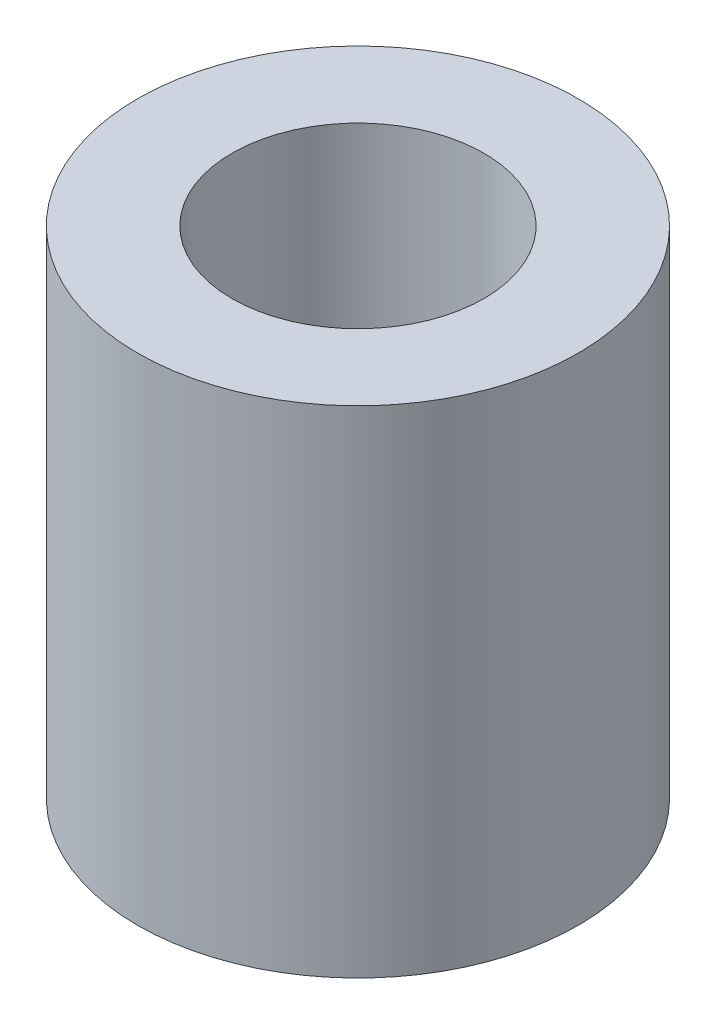
from build123d import *

# Parameters (mm, degrees)
SKETCH2_R           = 5.335
SKETCH2_R_2         = 3.05
BOSS_EXTRUDE1_DEPTH = 12


with BuildPart() as part:
    # Sketch2 → Boss-Extrude1 (new body)
    with BuildSketch(Plane(origin=(0, 0, 0), x_dir=(1, 0, 0), z_dir=(0, 1, 0))):
        Circle(SKETCH2_R)
        Circle(SKETCH2_R_2, mode=Mode.SUBTRACT)
    extrude(amount=BOSS_EXTRUDE1_DEPTH)


solid = part.part
